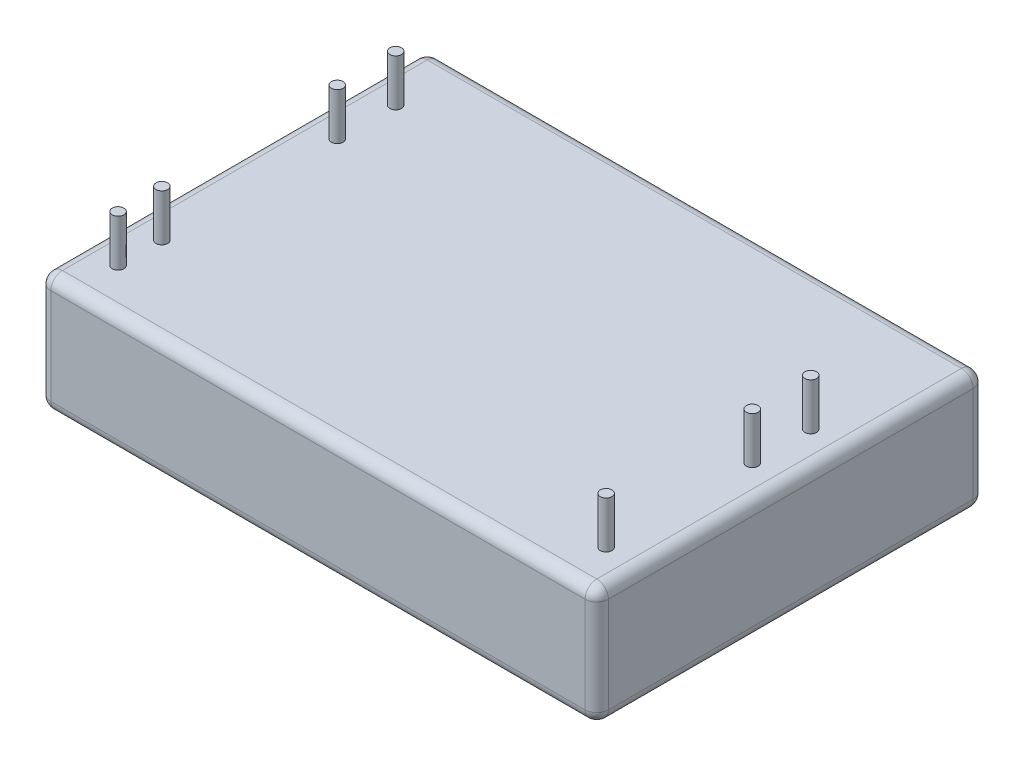
from build123d import *

# Parameters (mm, degrees)
SKETCH_1_W      = 47.7
SKETCH_1_H      = 33.2
EXTRUDE_1_DEPTH = 10.2
SKETCH_2_R      = 0.5
EXTRUDE_2_DEPTH = 4
FILLET_1_R      = 1
FILLET_2_R      = 1
FILLET_3_R      = 1
FILLET_4_R      = 1


with BuildPart() as part:
    # Эскиз1 → Бобышка-Вытянуть1 (new body)
    with BuildSketch(Plane(origin=(0, 0, 0), x_dir=(1, 0, 0), z_dir=(0, 1, 0))):
        Rectangle(SKETCH_1_W, SKETCH_1_H)
    extrude(amount=EXTRUDE_1_DEPTH)

    # Эскиз2 → Бобышка-Вытянуть2 (add)
    with BuildSketch(Plane(origin=(0, 10.2, 0), x_dir=(1, 0, 0), z_dir=(0, 1, 0))):
        with Locations(Location((-20.85, 5.9, 0), (0, 0, 270))):
            Circle(SKETCH_2_R)
        with Locations(Location((-20.85, 10.9, 0), (0, 0, 270))):
            Circle(SKETCH_2_R)
        with Locations(Location((-20.85, -12.85, 0), (0, 0, 270))):
            Circle(SKETCH_2_R)
        with Locations(Location((-20.85, -9.1, 0), (0, 0, 270))):
            Circle(SKETCH_2_R)
        with Locations(Location((20.9, -12.85, 0), (0, 0, 270))):
            Circle(SKETCH_2_R)
        with Locations(Location((20.9, -0.35, 0), (0, 0, 270))):
            Circle(SKETCH_2_R)
        with Locations(Location((20.9, 4.65, 0), (0, 0, 270))):
            Circle(SKETCH_2_R)
    extrude(amount=EXTRUDE_2_DEPTH)

    # Скругление1
    fillet_1_edges = [part.edges().sort_by_distance(p)[0] for p in [
        (0, 0, 16.6),
        (-23.85, 0, 0),
    ]]
    fillet(fillet_1_edges, radius=FILLET_1_R)

    # Скругление2
    fillet_2_edges = [part.edges().sort_by_distance(p)[0] for p in [
        (23.85, 0, -0.5),
        (-23.557106781, 0.292893219, -16.6),
        (23.85, 0.292893219, 16.307106781),
        (0.5, 0, -16.6),
        (23.85, 5.6, 16.6),
        (-23.85, 5.6, -16.6),
    ]]
    fillet(fillet_2_edges, radius=FILLET_2_R)

    # Скругление3
    # the kernel refuses this fillet: 1 mm, written as the material it takes off along each edge
    with BuildSketch(Plane(origin=(-22.85, 1, 15.6), x_dir=(0, 0, 1), z_dir=(-1, 0, 0))) as fillet_3_piece_1_section:
        Polygon((0, 0), (FILLET_3_R, 0), (FILLET_3_R, -FILLET_3_R), (0, -FILLET_3_R), align=None)
    fillet_3_piece_1 = extrude(amount=FILLET_3_R, mode=Mode.PRIVATE)
    fillet_3_piece_1 = fillet_3_piece_1 - Plane(origin=(-22.85, 1, 15.6), x_dir=(0, 0.7071067811865475, -0.7071067811865475), z_dir=(-1, 0, 0)) * Sphere(FILLET_3_R, mode=Mode.PRIVATE)
    add(fillet_3_piece_1, mode=Mode.SUBTRACT)
    with BuildSketch(Plane(origin=(-22.85, 9.2, 15.6), x_dir=(-1, 0, 0), z_dir=(0, 1, 0))) as fillet_3_piece_2_section:
        Polygon((0, 0), (FILLET_3_R, 0), (FILLET_3_R, FILLET_3_R), (0, FILLET_3_R), align=None)
    fillet_3_piece_2 = extrude(amount=FILLET_3_R, mode=Mode.PRIVATE)
    fillet_3_piece_2 = fillet_3_piece_2 - Plane(origin=(-22.85, 9.2, 15.6), x_dir=(0.7071067811865475, 0, -0.7071067811865475), z_dir=(0, 1, 0)) * Sphere(FILLET_3_R, mode=Mode.PRIVATE)
    add(fillet_3_piece_2, mode=Mode.SUBTRACT)
    with BuildSketch(Plane(origin=(22.85, 10.2, 16.6), x_dir=(0, 0, -1), z_dir=(-1, 0, 0))) as fillet_3_piece_3:
        with BuildLine():
            CenterArc((FILLET_3_R, FILLET_3_R), FILLET_3_R, 180, 90)
            Line((0, FILLET_3_R), (0, 0))
            Line((0, 0), (FILLET_3_R, 0))
        make_face()
    extrude(amount=45.7, mode=Mode.SUBTRACT)
    with BuildSketch(Plane(origin=(23.85, 10.2, -19.1), x_dir=(-1, 0, 0), z_dir=(0, 0, 1))) as fillet_3_piece_4:
        with BuildLine():
            CenterArc((FILLET_3_R, FILLET_3_R), FILLET_3_R, 180, 90)
            Line((0, FILLET_3_R), (0, 0))
            Line((0, 0), (FILLET_3_R, 0))
        make_face()
    extrude(amount=34.7, mode=Mode.SUBTRACT)
    with BuildSketch(Plane(origin=(-23.85, 10.2, 15.6), x_dir=(1, 0, 0), z_dir=(0, 0, -1))) as fillet_3_piece_5:
        with BuildLine():
            CenterArc((FILLET_3_R, FILLET_3_R), FILLET_3_R, 180, 90)
            Line((0, FILLET_3_R), (0, 0))
            Line((0, 0), (FILLET_3_R, 0))
        make_face()
    extrude(amount=31.2, mode=Mode.SUBTRACT)
    with BuildSketch(Plane(origin=(-22.85, 10.2, -15.6), x_dir=(0, 0, -1), z_dir=(1, 0, 0))) as fillet_3_piece_6:
        with BuildLine():
            CenterArc((1 - FILLET_3_R, -FILLET_3_R), FILLET_3_R, 0, 90)
            Line((1, -FILLET_3_R), (1, 0))
            Line((1, 0), (1 - FILLET_3_R, 0))
        make_face()
    revolve(axis=Axis((-22.85, 10.2, -15.6), (0, 1, 0)), revolution_arc=90, mode=Mode.SUBTRACT)
    with BuildSketch(Plane(origin=(22.85, 10.2, 15.6), x_dir=(0, 0, 1), z_dir=(-1, 0, 0))) as fillet_3_piece_7:
        with BuildLine():
            CenterArc((1 - FILLET_3_R, -FILLET_3_R), FILLET_3_R, 0, 90)
            Line((1, -FILLET_3_R), (1, 0))
            Line((1, 0), (1 - FILLET_3_R, 0))
        make_face()
    revolve(axis=Axis((22.85, 10.2, 15.6), (0, 1, 0)), revolution_arc=90, mode=Mode.SUBTRACT)
    with BuildSketch(Plane(origin=(-22.85, 10.2, -16.6), x_dir=(0, -1, 0), z_dir=(1, 0, 0))) as fillet_3_piece_8:
        with BuildLine():
            CenterArc((FILLET_3_R, -FILLET_3_R), FILLET_3_R, 90, 90)
            Line((0, -FILLET_3_R), (0, 0))
            Line((0, 0), (FILLET_3_R, 0))
        make_face()
    extrude(amount=49.2, mode=Mode.SUBTRACT)
    with BuildSketch(Plane(origin=(-23.85, 1, 16.6), x_dir=(0, 0, -1), z_dir=(0, 1, 0))) as fillet_3_piece_9:
        with BuildLine():
            CenterArc((FILLET_3_R, -FILLET_3_R), FILLET_3_R, 90, 90)
            Line((0, -FILLET_3_R), (0, 0))
            Line((0, 0), (FILLET_3_R, 0))
        make_face()
    extrude(amount=8.2, mode=Mode.SUBTRACT)

    # Скругление4
    # the kernel refuses this fillet: 1 mm, written as the material it takes off along each edge
    with BuildSketch(Plane(origin=(22.85, 1, -15.6), x_dir=(1, 0, 0), z_dir=(0, 0, -1))) as fillet_4_piece_1_section:
        Polygon((0, 0), (FILLET_4_R, 0), (FILLET_4_R, FILLET_4_R), (0, FILLET_4_R), align=None)
    fillet_4_piece_1 = extrude(amount=FILLET_4_R, mode=Mode.PRIVATE)
    fillet_4_piece_1 = fillet_4_piece_1 - Plane(origin=(22.85, 1, -15.6), x_dir=(-0.7071067811865475, 0.7071067811865475, 0), z_dir=(0, 0, -1)) * Sphere(FILLET_4_R, mode=Mode.PRIVATE)
    add(fillet_4_piece_1, mode=Mode.SUBTRACT)
    with BuildSketch(Plane(origin=(22.85, 9.2, -15.6), x_dir=(1, 0, 0), z_dir=(0, 0, -1))) as fillet_4_piece_2_section:
        Polygon((0, 0), (FILLET_4_R, 0), (FILLET_4_R, -FILLET_4_R), (0, -FILLET_4_R), align=None)
    fillet_4_piece_2 = extrude(amount=FILLET_4_R, mode=Mode.PRIVATE)
    fillet_4_piece_2 = fillet_4_piece_2 - Plane(origin=(22.85, 9.2, -15.6), x_dir=(-0.7071067811865475, -0.7071067811865475, 0), z_dir=(0, 0, -1)) * Sphere(FILLET_4_R, mode=Mode.PRIVATE)
    add(fillet_4_piece_2, mode=Mode.SUBTRACT)
    with BuildSketch(Plane(origin=(23.85, 1, -16.6), x_dir=(-1, 0, 0), z_dir=(0, 1, 0))) as fillet_4_piece_3:
        with BuildLine():
            CenterArc((FILLET_4_R, FILLET_4_R), FILLET_4_R, 180, 90)
            Line((0, FILLET_4_R), (0, 0))
            Line((0, 0), (FILLET_4_R, 0))
        make_face()
    extrude(amount=8.2, mode=Mode.SUBTRACT)


solid = part.part
